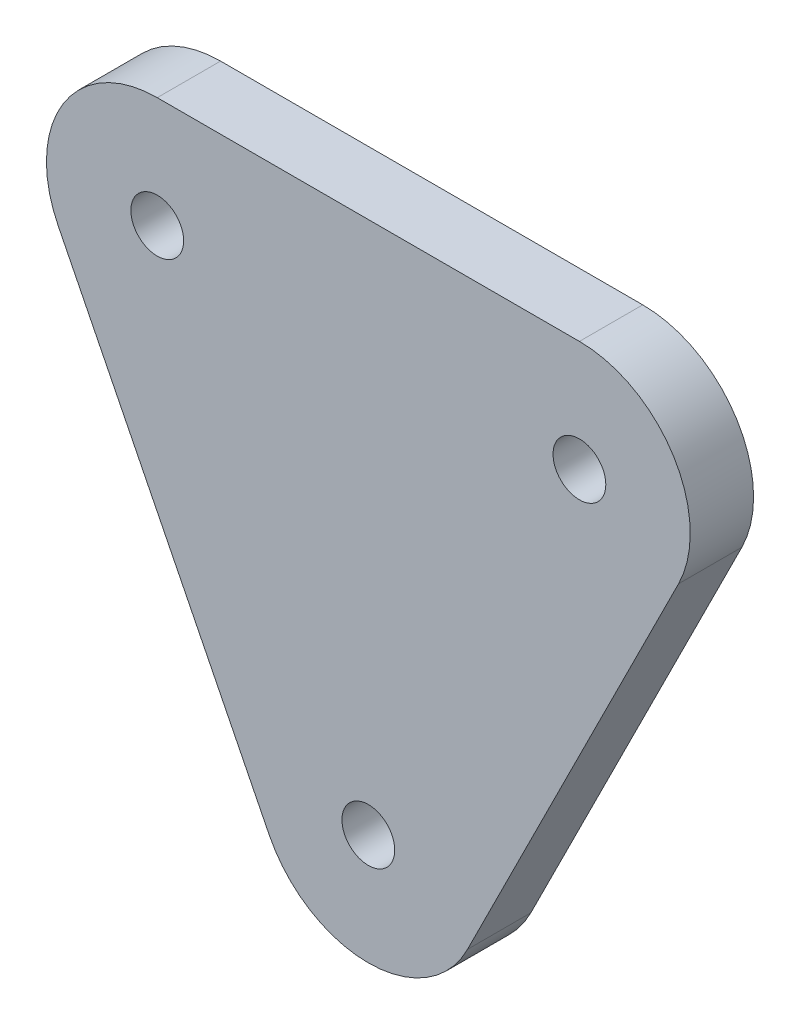
from build123d import *

# Parameters (mm, degrees)
ESBO_O1_R                = 2.5
RESSALTO_EXTRUS_O1_DEPTH = 6


with BuildPart() as part:
    # Esboço1 → Ressalto-extrusão1 (new body)
    with BuildSketch(Plane.XY):
        with BuildLine():
            Line((-20, 30.5), (20, 30.5))
            ThreePointArc((20, 30.5), (28.931833488, 25.520176677), (29.391485505, 15.304257247))
            Line((29.391485505, 15.304257247), (9.391485505, -24.695742753))
            ThreePointArc((9.391485505, -24.695742753), (0, -30.5), (-9.391485505, -24.695742753))
            Line((-9.391485505, -24.695742753), (-29.391485505, 15.304257247))
            ThreePointArc((-29.391485505, 15.304257247), (-28.931833488, 25.520176677), (-20, 30.5))
        make_face()
        with Locations((-20, 20)):
            Circle(ESBO_O1_R, mode=Mode.SUBTRACT)
        with Locations((20, 20)):
            Circle(ESBO_O1_R, mode=Mode.SUBTRACT)
        with Locations((0, -20)):
            Circle(ESBO_O1_R, mode=Mode.SUBTRACT)
    extrude(amount=RESSALTO_EXTRUS_O1_DEPTH)


solid = part.part
